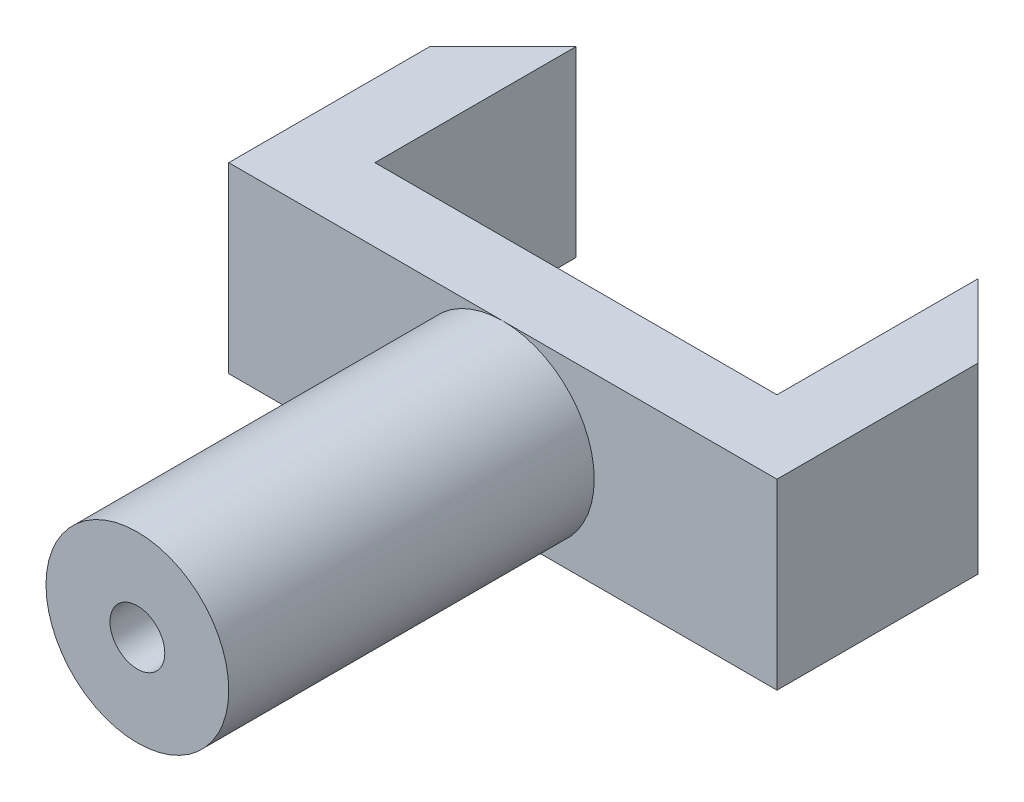
from build123d import *

# Parameters (mm, degrees)
SKETCH2_R           = 50
SKETCH2_R_2         = 15
BOSS_EXTRUDE1_DEPTH = 200
BOSS_EXTRUDE2_DEPTH = 40
SKETCH4_W           = 40
SKETCH4_H           = 100
BOSS_EXTRUDE3_DEPTH = 120
CHAMFER1_SIZE       = 50
CHAMFER2_SIZE       = 50


with BuildPart() as part:
    # Sketch2 → Boss-Extrude1 (new body)
    with BuildSketch(Plane.XY):
        Circle(SKETCH2_R)
        Circle(SKETCH2_R_2, mode=Mode.SUBTRACT)
    extrude(amount=BOSS_EXTRUDE1_DEPTH)

    # Sketch3 → Boss-Extrude2 (add)
    with BuildSketch(Plane(origin=(0, 0, 0), x_dir=(-1, 0, 0), z_dir=(0, 0, -1))):
        Polygon((-150, 50), (-150, 33.43588559), (-150, -50), (150, -50), (150, 50), align=None)
    extrude(amount=BOSS_EXTRUDE2_DEPTH)

    # Sketch4 → Boss-Extrude3 (add)
    with BuildSketch(Plane(origin=(0, 0, -40), x_dir=(-1, 0, 0), z_dir=(0, 0, -1))):
        Polygon((110, 50), (110, 33.823115264), (110, -50), (150, -50), (150, 50), align=None)
        with Locations((-130, 0)):
            Rectangle(SKETCH4_W, SKETCH4_H)
    extrude(amount=BOSS_EXTRUDE3_DEPTH)

    # Chamfer1
    # the kernel refuses this chamfer: 50 mm, written as the material it takes off along each edge
    with BuildSketch(Plane(origin=(-150, -178.584149398, -160), x_dir=(0.9996219169112966, 0, -0.027495876610586594), z_dir=(0, 1, 0))) as chamfer1_piece_1:
        Polygon((CHAMFER1_SIZE * 0.999621916911, -CHAMFER1_SIZE * 0.0274958766106), (-CHAMFER1_SIZE * 0.0274958766106, -CHAMFER1_SIZE * 0.999621916911), (0, 0), align=None)
    extrude(amount=357.168298797, mode=Mode.SUBTRACT)

    # Chamfer2
    # the kernel refuses this chamfer: 50 mm, written as the material it takes off along each edge
    with BuildSketch(Plane(origin=(150, -178.584149398, -160), x_dir=(0.027495876610586594, 0, 0.9996219169112966), z_dir=(0, 1, 0))) as chamfer2_piece_1:
        Polygon((CHAMFER2_SIZE * 0.999621916911, -CHAMFER2_SIZE * 0.0274958766106), (-CHAMFER2_SIZE * 0.0274958766106, -CHAMFER2_SIZE * 0.999621916911), (0, 0), align=None)
    extrude(amount=357.168298797, mode=Mode.SUBTRACT)


solid = part.part
